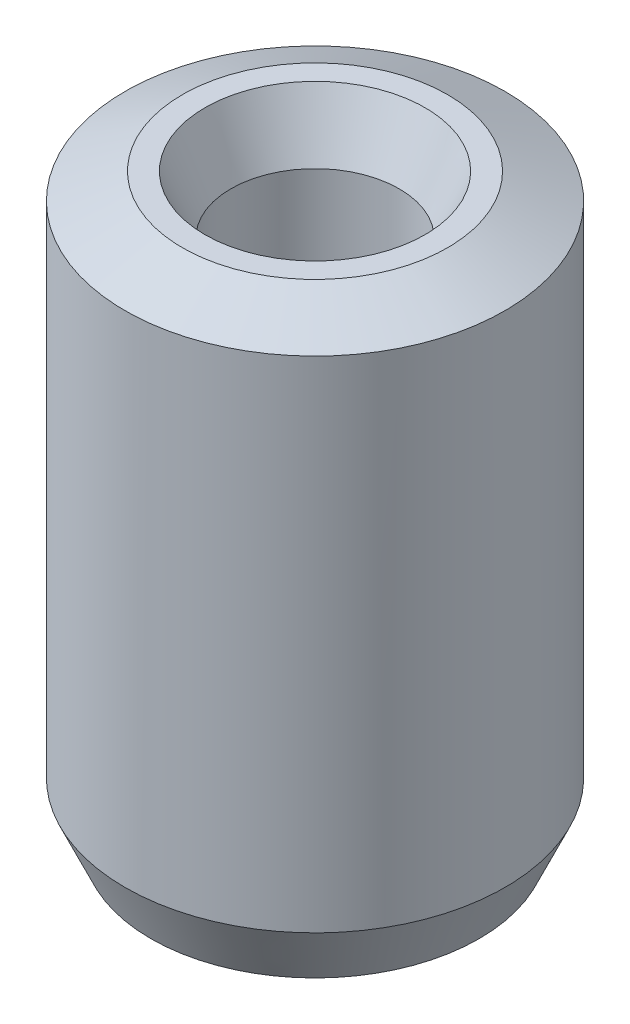
from build123d import *
from OCP.BRepFilletAPI import BRepFilletAPI_MakeChamfer

# Parameters (mm, degrees)
SKETCH1_R           = 27.5
BOSS_EXTRUDE1_DEPTH = 84.3537559
SKETCH2_R           = 12.189279116
CUT_EXTRUDE1_DEPTH  = 93.887330322
CHAMFER1_SIZE       = 3.742533436
CHAMFER1_SIZE2      = 8.299721851


with BuildPart() as part:
    # Sketch1 → Boss-Extrude1 (new body)
    with BuildSketch(Plane(origin=(0, 0, 0), x_dir=(1, 0, 0), z_dir=(0, 1, 0))):
        Circle(SKETCH1_R)
    extrude(amount=BOSS_EXTRUDE1_DEPTH)

    # Sketch2 → Cut-Extrude1 (cut, through all)
    with BuildSketch(Plane(origin=(0, 0, 0), x_dir=(1, 0, 0), z_dir=(0, 1, 0))):
        Circle(SKETCH2_R)
    extrude(amount=CUT_EXTRUDE1_DEPTH, mode=Mode.SUBTRACT)

    # Chamfer1: one chamfer whose edges measure the first distance from different faces: ONE call of the kernel's chamfer builder (chamfer() names one face for all edges)
    chamfer1_edges_1 = [part.edges().sort_by_distance(p)[0] for p in [
        (-12.189279116, 84.3537559, 0),
    ]]
    chamfer1_side_1 = [part.faces().sort_by_distance(p)[0] for p in [
        (-26.722182541, 84.3537559, 0),
    ]]
    chamfer1_edges_2 = [part.edges().sort_by_distance(p)[0] for p in [
        (-12.189279116, 0, 0),
    ]]
    chamfer1_side_2 = [part.faces().sort_by_distance(p)[0] for p in [
        (-12.189279116, 42.17687795, 0),
    ]]
    chamfer1_edges_3 = [part.edges().sort_by_distance(p)[0] for p in [
        (-27.5, 0, 0),
    ]]
    chamfer1_side_3 = [part.faces().sort_by_distance(p)[0] for p in [
        (-26.722182541, 0, 0),
    ]]
    chamfer1_edges_4 = [part.edges().sort_by_distance(p)[0] for p in [
        (-27.5, 84.3537559, 0),
    ]]
    chamfer1_side_4 = [part.faces().sort_by_distance(p)[0] for p in [
        (-27.5, 42.17687795, 0),
    ]]
    chamfer1 = BRepFilletAPI_MakeChamfer(part.part.solid().wrapped)
    for e in chamfer1_edges_1:
        chamfer1.Add(CHAMFER1_SIZE, CHAMFER1_SIZE2, e.wrapped, chamfer1_side_1[0].wrapped)  # the first distance lies on this face
    for e in chamfer1_edges_2:
        chamfer1.Add(CHAMFER1_SIZE, CHAMFER1_SIZE2, e.wrapped, chamfer1_side_2[0].wrapped)  # the first distance lies on this face
    for e in chamfer1_edges_3:
        chamfer1.Add(CHAMFER1_SIZE, CHAMFER1_SIZE2, e.wrapped, chamfer1_side_3[0].wrapped)  # the first distance lies on this face
    for e in chamfer1_edges_4:
        chamfer1.Add(CHAMFER1_SIZE, CHAMFER1_SIZE2, e.wrapped, chamfer1_side_4[0].wrapped)  # the first distance lies on this face
    add(Compound.cast(chamfer1.Shape()), mode=Mode.REPLACE)


solid = part.part
